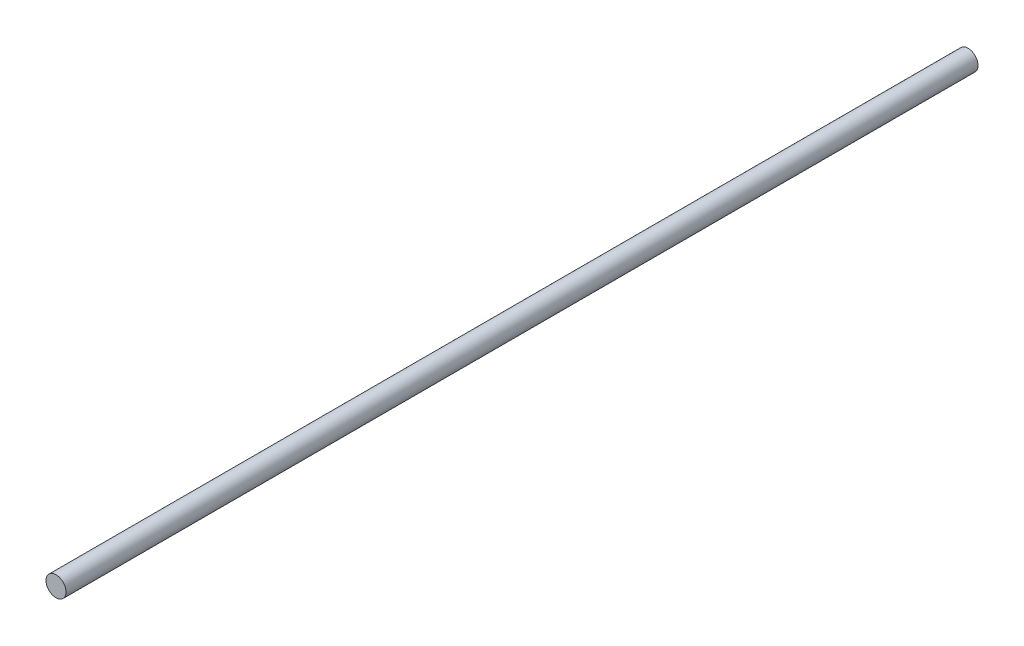
from build123d import *

# Parameters (mm, degrees)
SKETCH1_R           = 2
BOSS_EXTRUDE1_DEPTH = 182.2


with BuildPart() as part:
    # Sketch1 → Boss-Extrude1 (new body)
    with BuildSketch(Plane.XY):
        Circle(SKETCH1_R)
    extrude(amount=BOSS_EXTRUDE1_DEPTH)


solid = part.part
